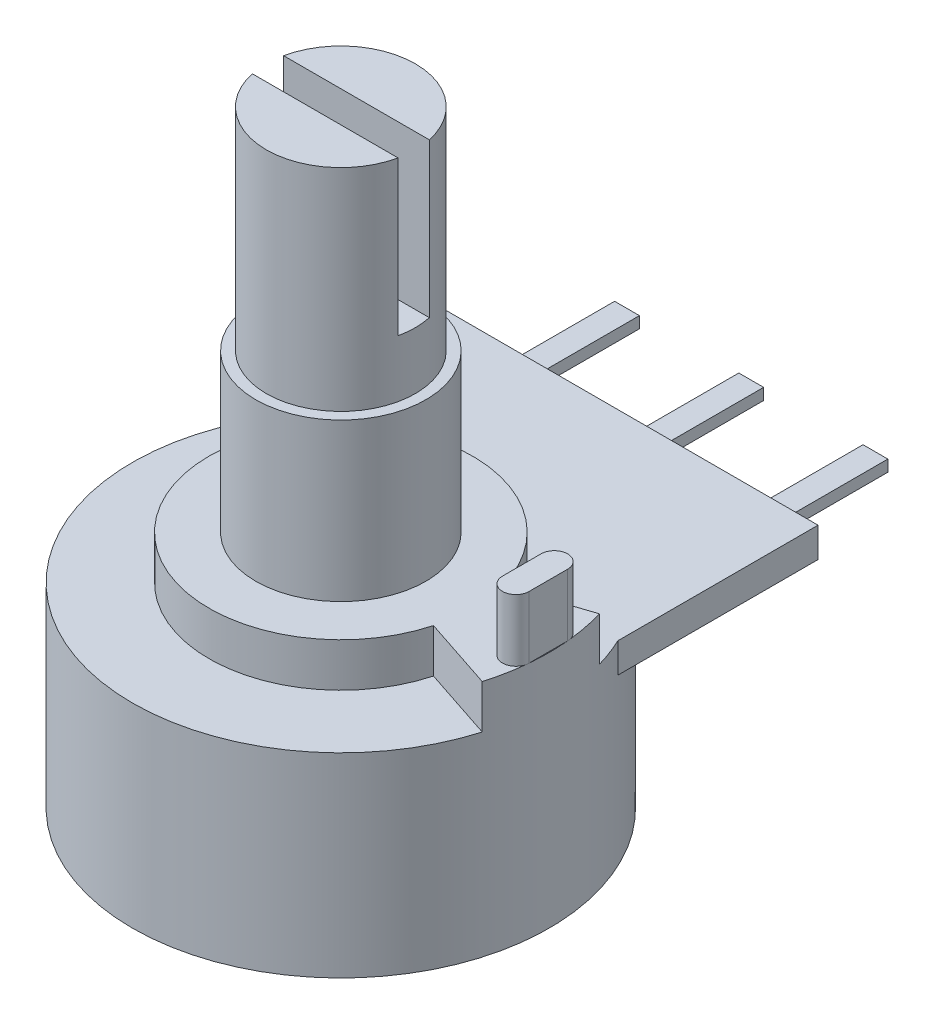
from build123d import *

# Parameters (mm, degrees)
CUT_EXTRUDE1_DEPTH  = 6.2
BOSS_EXTRUDE1_DEPTH = 1.2
SKETCH5_W           = 6
SKETCH5_H           = 0.46
BOSS_EXTRUDE2_DEPTH = 0.5
LPATTERN1_COUNT     = 2
LPATTERN1_PITCH     = 5
LPATTERN1_COL_COUNT = 2
LPATTERN1_COL_PITCH = 5
BOSS_EXTRUDE3_START = 1.76
BOSS_EXTRUDE3_DEPTH = 1.76
BOSS_EXTRUDE4_DEPTH = 2.5


# Read off the part's stored shape, not the designer's step: Boss-Extrude4
with BuildPart() as part:
    # Sketch1 → Revolve1 (revolve)
    with BuildSketch(Plane(origin=(0, 0, 0), x_dir=(0, 0, -1), z_dir=(1, 0, 0))):
        Polygon((0, 0), (-8.39, 0), (-8.39, 7.85), (-5.305, 7.85), (-5.305, 9.61), (-3.425, 9.61), (-3.425, 15.94), (-3, 15.94), (-3, 24.44), (0, 24.44), align=None)
    revolve(axis=Axis((0, 0, 0), (0, -1, 0)))

    # Sketch3 → Cut-Extrude1 (cut)
    with BuildSketch(Plane(origin=(0, 24.44, 0), x_dir=(1, 0, 0), z_dir=(0, 1, 0))):
        with BuildLine():
            Line((-2.933104158, -0.63), (2.933104158, -0.63))
            ThreePointArc((2.933104158, -0.63), (3, 0), (2.933104158, 0.63))
            Line((2.933104158, 0.63), (-2.933104158, 0.63))
            ThreePointArc((-2.933104158, 0.63), (-3, 0), (-2.933104158, -0.63))
        make_face()
    extrude(amount=-CUT_EXTRUDE1_DEPTH, mode=Mode.SUBTRACT)

    # Sketch4 → Boss-Extrude1 (add)
    with BuildSketch(Plane(origin=(0, 7.85, 0), x_dir=(1, 0, 0), z_dir=(0, 1, 0))):
        with BuildLine():
            Line((-7.6, 3.554166569), (-7.6, 11.61))
            Line((-7.6, 11.61), (7.6, 11.61))
            Line((7.6, 11.61), (7.6, 3.554166569))
            ThreePointArc((7.6, 3.554166569), (0, 8.39), (-7.6, 3.554166569))
        make_face()
    extrude(amount=-BOSS_EXTRUDE1_DEPTH)

    # Sketch5 → Boss-Extrude2 (add, symmetric)
    with BuildSketch(Plane(origin=(0, 0, 0), x_dir=(0, 0, -1), z_dir=(1, 0, 0))):
        with Locations((13.52, 6.42)):
            Rectangle(SKETCH5_W, SKETCH5_H)
    boss_extrude2 = extrude(amount=BOSS_EXTRUDE2_DEPTH, both=True)

    # LPattern1: Boss-Extrude2 ×2
    with Locations(*[(i * LPATTERN1_PITCH, 0, 0) for i in range(1, LPATTERN1_COUNT)]):
        add(boss_extrude2)

    # LPattern1 col: Boss-Extrude2 ×2
    with Locations(*[(-i * LPATTERN1_COL_PITCH, 0, 0) for i in range(1, LPATTERN1_COL_COUNT)]):
        add(boss_extrude2)

    # Sketch6 → Boss-Extrude3 (add)
    with BuildSketch(Plane(origin=(0, 7.85, 0), x_dir=(1, 0, 0), z_dir=(0, 1, 0)).offset(BOSS_EXTRUDE3_START)):
        with BuildLine():
            Line((5.119660633, 1.39), (8.05124214, 2.36))
            ThreePointArc((8.05124214, 2.36), (8.39, 0), (8.05124214, -2.36))
            Line((8.05124214, -2.36), (5.119660633, -1.39))
            ThreePointArc((5.119660633, -1.39), (5.305, 0), (5.119660633, 1.39))
        make_face()
    extrude(amount=-BOSS_EXTRUDE3_DEPTH)

    # Boss-Extrude4 outline → Boss-Extrude4 (add)
    with BuildSketch(Plane(origin=(0, 9.61, 0), x_dir=(1, 0, 0), z_dir=(0, 1, 0))):
        with BuildLine():
            ThreePointArc((8.354129219, 0.775), (7.819129219, 1.31), (7.284129219, 0.775))
            Line((7.284129219, 0.775), (7.284129219, -0.775))
            ThreePointArc((7.284129219, -0.775), (7.819129219, -1.31), (8.354129219, -0.775))
            Line((8.354129219, -0.775), (8.354129219, 0.775))
        make_face()
    extrude(amount=BOSS_EXTRUDE4_DEPTH)


solid = part.part
